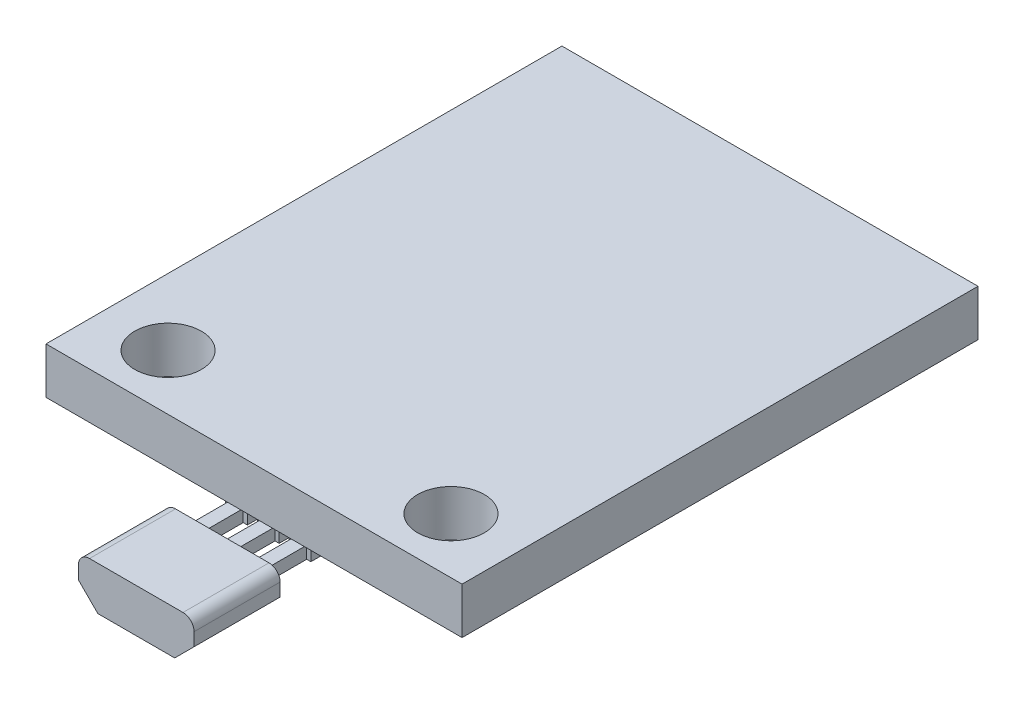
from build123d import *

# Parameters (mm, degrees)
RESSALTO_EXTRUS_O1_DEPTH = 3.1
ESBO_O3_W                = 0.48
ESBO_O3_H                = 0.44
RESSALTO_EXTRUS_O2_DEPTH = 16.26
CHANFRO1_SIZE            = 0.7
ESBO_O5_W                = 0.15
ESBO_O5_H                = 0.5
RESSALTO_EXTRUS_O4_DEPTH = 0.44
SKETCH2_W                = 15
SKETCH2_H                = 18.6
BOSS_EXTRUDE1_DEPTH      = 1.67
SKETCH3_W                = 2.77
SKETCH3_H                = 5.31438776
CUT_EXTRUDE1_DEPTH       = 0.7
SKETCH4_R                = 1.2
CUT_EXTRUDE2_DEPTH       = 2.7


with BuildPart() as part:
    # Esboço1 → Ressalto-extrusão1 (new body)
    with BuildSketch(Plane.XY):
        with BuildLine():
            Line((0.7, 0), (0, 0.7))
            Line((0, 0.7), (0, 1.17))
            ThreePointArc((0, 1.17), (0.117157288, 1.452842712), (0.4, 1.57))
            Line((0.4, 1.57), (3.77, 1.57))
            ThreePointArc((3.77, 1.57), (4.052842712, 1.452842712), (4.17, 1.17))
            Line((4.17, 1.17), (4.17, 0.7))
            Line((4.17, 0.7), (3.47, 0))
            Line((3.47, 0), (0.7, 0))
        make_face()
    extrude(amount=RESSALTO_EXTRUS_O1_DEPTH)

    # Esboço3 → Ressalto-extrusão2 (add)
    with BuildSketch(Plane.XY):
        with Locations((3.23, 0.92)):
            Rectangle(ESBO_O3_W, ESBO_O3_H)
        with Locations((0.94, 0.92)):
            Rectangle(ESBO_O3_W, ESBO_O3_H)
        with Locations((2.085, 0.92)):
            Rectangle(ESBO_O3_W, ESBO_O3_H)
    extrude(amount=-RESSALTO_EXTRUS_O2_DEPTH)

    # Chanfro1
    chanfro1_edges = [part.edges().sort_by_distance(p)[0] for p in [
        (2.085, 0, 0),
    ]]
    chamfer(chanfro1_edges, length=CHANFRO1_SIZE - 0.0001)  # a hair under: the kernel refuses the full size

    # Esboço5 → Ressalto-extrusão4 (add)
    with BuildSketch(Plane.XZ.offset(-0.7)):
        with Locations((0.625, -1.91)):
            Rectangle(ESBO_O5_W, ESBO_O5_H)
        with Locations((1.255, -1.91)):
            Rectangle(ESBO_O5_W, ESBO_O5_H)
        with Locations((2.4, -1.91)):
            Rectangle(ESBO_O5_W, ESBO_O5_H)
        with Locations((3.545, -1.91)):
            Rectangle(ESBO_O5_W, ESBO_O5_H)
        with Locations((1.77, -1.91)):
            Rectangle(ESBO_O5_W, ESBO_O5_H)
        with Locations((2.915, -1.91)):
            Rectangle(ESBO_O5_W, ESBO_O5_H)
    extrude(amount=-RESSALTO_EXTRUS_O4_DEPTH)

    # Sketch3 → Cut-Extrude1 (cut)
    with BuildSketch(Plane.XZ.offset(-0.7)):
        with Locations((2.085, -13.60280612)):
            Rectangle(SKETCH3_W, SKETCH3_H)
    extrude(amount=-CUT_EXTRUDE1_DEPTH, mode=Mode.SUBTRACT)


with BuildPart() as body_2:
    # Sketch2 → Boss-Extrude1 (new body)
    with BuildSketch(Plane(origin=(0, 1.57, 0), x_dir=(1, 0, 0), z_dir=(0, 1, 0))):
        with Locations((2.085, 10.44561224)):
            Rectangle(SKETCH2_W, SKETCH2_H)
    extrude(amount=BOSS_EXTRUDE1_DEPTH)

    # Sketch4 → Cut-Extrude2 (cut)
    with BuildSketch(Plane.XZ.offset(-1.57)):
        with Locations(Location((-3.015, -3.14561224, 0), (0, 0, 270))):
            Circle(SKETCH4_R)
        with Locations(Location((7.185, -3.14561224, 0), (0, 0, 270))):
            Circle(SKETCH4_R)
    extrude(amount=-CUT_EXTRUDE2_DEPTH, mode=Mode.SUBTRACT)


solid = Compound([part.part, body_2.part])
